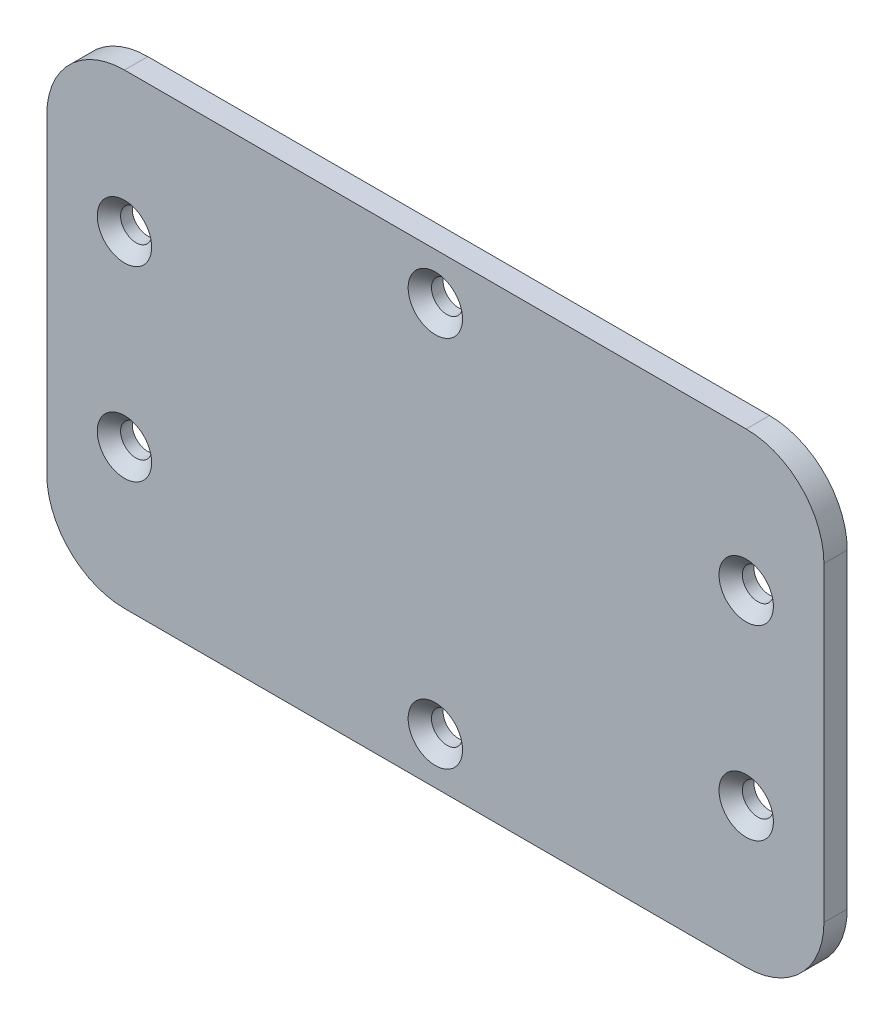
from build123d import *

# Parameters (mm, degrees)
SKIZZE1_W                                            = 50
SKIZZE1_H                                            = 30
BASIS_BLECH1_DEPTH                                   = 1.5
VERRUNDUNG1_R                                        = 5
FORMSENKUNG_F_R_M3_SENKSCHRAUBE_MIT_INNE_D           = 1.6
FORMSENKUNG_F_R_M3_SENKSCHRAUBE_MIT_INNE_DEPTH       = 8
FORMSENKUNG_F_R_M3_SENKSCHRAUBE_MIT_INNE_CSINK_D     = 3.5
FORMSENKUNG_F_R_M3_SENKSCHRAUBE_MIT_INNE_CSINK_ANGLE = 90
FORMSENKUNG_F_R_M3_SENKSCHRAUBE_MIT_INNE_TIP         = 0.480688495
SKIZZE8_R                                            = 1
SCHNITT_LINEAR_AUSTRAGEN1_DEPTH                      = 30.193321154


# Sheet-metal steps are written as plain solids
with BuildPart() as part:
    # Skizze1 → Basis-Blech1 (new body)
    with BuildSketch(Plane.XY):
        Rectangle(SKIZZE1_W, SKIZZE1_H)
    extrude(amount=-BASIS_BLECH1_DEPTH)

    # Verrundung1
    verrundung1_edges = [part.edges().sort_by_distance(p)[0] for p in [
        (-25, 15, -0.75),
        (25, 15, -0.75),
        (25, -15, -0.75),
        (-25, -15, -0.75),
    ]]
    fillet(verrundung1_edges, radius=VERRUNDUNG1_R)

    # Formsenkung für M3 Senkschraube mit Innensechskant2
    with Locations(Plane(origin=(-12.308549643, 4.902846213, 0), x_dir=(-1, 0, 0), z_dir=(0, 0, 1))):
        with Locations((-32.308549643, -1.097153787), (-12.308549643, -7.097153787), (7.691450357, -1.097153787), (7.691450357, 10.902846213), (-12.308549643, 16.902846213), (-32.308549643, 10.902846213)):
            CounterSinkHole(FORMSENKUNG_F_R_M3_SENKSCHRAUBE_MIT_INNE_D / 2, FORMSENKUNG_F_R_M3_SENKSCHRAUBE_MIT_INNE_CSINK_D / 2, depth=FORMSENKUNG_F_R_M3_SENKSCHRAUBE_MIT_INNE_DEPTH, counter_sink_angle=FORMSENKUNG_F_R_M3_SENKSCHRAUBE_MIT_INNE_CSINK_ANGLE)
            with Locations((0, 0, -(FORMSENKUNG_F_R_M3_SENKSCHRAUBE_MIT_INNE_DEPTH + FORMSENKUNG_F_R_M3_SENKSCHRAUBE_MIT_INNE_TIP / 2))):  # 118° drill point
                Cone(0, FORMSENKUNG_F_R_M3_SENKSCHRAUBE_MIT_INNE_D / 2, FORMSENKUNG_F_R_M3_SENKSCHRAUBE_MIT_INNE_TIP, mode=Mode.SUBTRACT)

    # Skizze8 → Schnitt-Linear austragen1 (cut, through all)
    with BuildSketch(Plane(origin=(0, 0, -1.5), x_dir=(-1, 0, 0), z_dir=(0, 0, -1))):
        with Locations((-20, 6)):
            Circle(SKIZZE8_R)
        with Locations((0, 12)):
            Circle(SKIZZE8_R)
        with Locations((20, 6)):
            Circle(SKIZZE8_R)
        with Locations((20, -6)):
            Circle(SKIZZE8_R)
        with Locations((0, -12)):
            Circle(SKIZZE8_R)
        with Locations((-20, -6)):
            Circle(SKIZZE8_R)
    extrude(amount=-SCHNITT_LINEAR_AUSTRAGEN1_DEPTH, mode=Mode.SUBTRACT)


solid = part.part
